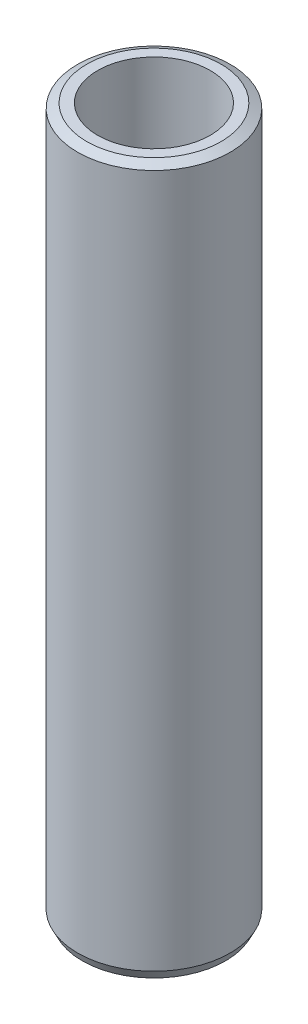
from build123d import *
from OCP.BRepFilletAPI import BRepFilletAPI_MakeChamfer

# Parameters (mm, degrees)
SKETCH1_R           = 35
BOSS_EXTRUDE1_DEPTH = 324.543361116
SKETCH2_R           = 25.820713947
CUT_EXTRUDE1_DEPTH  = 329.296197427
CHAMFER1_SIZE       = 2.141470098
CHAMFER1_SIZE2      = 4.198418708


with BuildPart() as part:
    # Sketch1 → Boss-Extrude1 (new body)
    with BuildSketch(Plane(origin=(0, 0, 0), x_dir=(1, 0, 0), z_dir=(0, 1, 0))):
        Circle(SKETCH1_R)
    extrude(amount=BOSS_EXTRUDE1_DEPTH)

    # Sketch2 → Cut-Extrude1 (cut, through all)
    with BuildSketch(Plane(origin=(0, 0, 0), x_dir=(1, 0, 0), z_dir=(0, 1, 0))):
        Circle(SKETCH2_R)
    extrude(amount=CUT_EXTRUDE1_DEPTH, mode=Mode.SUBTRACT)

    # Chamfer1: one chamfer whose edges measure the first distance from different faces: ONE call of the kernel's chamfer builder (chamfer() names one face for all edges)
    chamfer1_edges_1 = [part.edges().sort_by_distance(p)[0] for p in [
        (-35, 324.543361116, 0),
    ]]
    chamfer1_side_1 = [part.faces().sort_by_distance(p)[0] for p in [
        (-35, 162.271680558, 0),
    ]]
    chamfer1_edges_2 = [part.edges().sort_by_distance(p)[0] for p in [
        (-35, 0, 0),
    ]]
    chamfer1_side_2 = [part.faces().sort_by_distance(p)[0] for p in [
        (-34.010050506, 0, 0),
    ]]
    chamfer1 = BRepFilletAPI_MakeChamfer(part.part.solid().wrapped)
    for e in chamfer1_edges_1:
        chamfer1.Add(CHAMFER1_SIZE, CHAMFER1_SIZE2, e.wrapped, chamfer1_side_1[0].wrapped)  # the first distance lies on this face
    for e in chamfer1_edges_2:
        chamfer1.Add(CHAMFER1_SIZE, CHAMFER1_SIZE2, e.wrapped, chamfer1_side_2[0].wrapped)  # the first distance lies on this face
    add(Compound.cast(chamfer1.Shape()), mode=Mode.REPLACE)


solid = part.part
